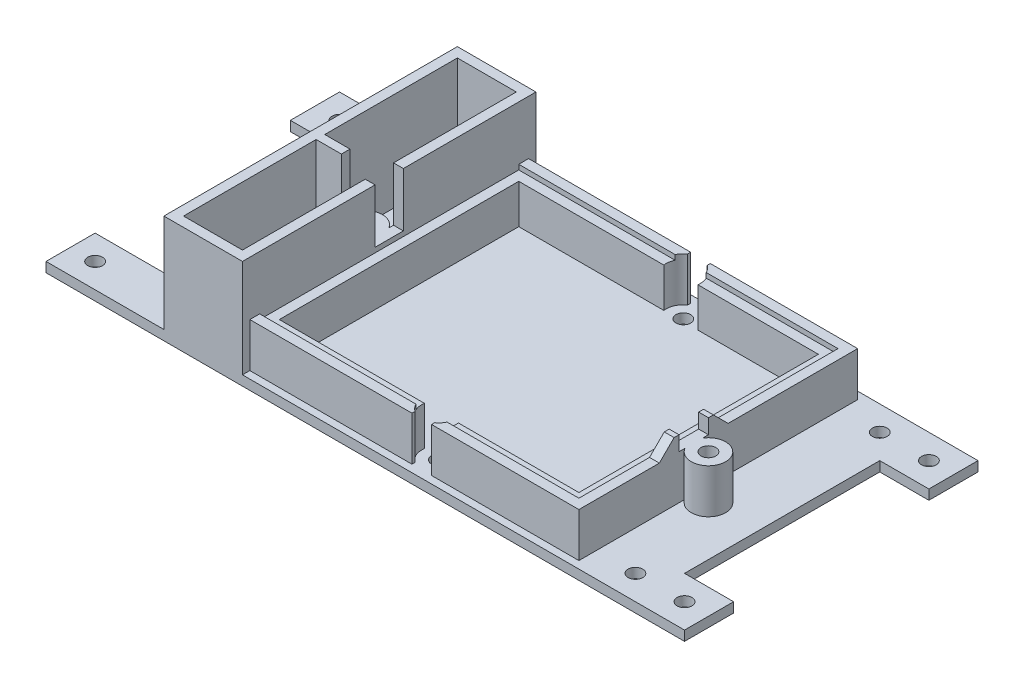
from build123d import *

# Parameters (mm, degrees)
SZKIC1_W                        = 10
SZKIC1_H                        = 10
DODANIE_WYCI_GNI_CIE1_DEPTH     = 2
SZKIC3_R                        = 1.5
DODANIE_WYCI_GNI_CIE2_DEPTH     = 2
DODANIE_WYCI_GNI_CIE11_DEPTH    = 8
DODANIE_WYCI_GNI_CIE12_DEPTH    = 20
DODANIE_WYCI_GNI_CIE13_DEPTH    = 9
SZKIC7_R                        = 1.5
WYTNIJ_WYCI_GNI_CIE1_DEPTH      = 85.018427919
DODANIE_WYCI_GNI_CIE15_DEPTH    = 9
SZKIC9_W                        = 2
SZKIC9_H                        = 25.25
SZKIC9_W_2                      = 5.139687394
SZKIC9_H_2                      = 1
DODANIE_WYCI_GNI_CIE16_DEPTH    = 11
SZKIC10_R                       = 1.5
WYTNIJ_WYCI_GNI_CIE2_DEPTH      = 85.51683992
LUSTRO4_OUTLINE_R               = 1.5
LUSTRO4_DEPTH                   = 2
LUSTRO4_START                   = 2
LUSTRO4_2_DEPTH                 = 8
LUSTRO4_START_2                 = 10
LUSTRO4_3_DEPTH                 = 12
LUSTRO4_4_DEPTH                 = 1
WYTNIJ_WYCI_GNI_CIE3_DEPTH      = 85.018427919
WYTNIJ_WYCI_GNI_CIE3_DEPTH_BACK = 85.018427919
SZKIC11_R                       = 1.5
DODANIE_WYCI_GNI_CIE17_START    = 9
SZKIC12_R                       = 3.5
SZKIC12_R_2                     = 1.5
DODANIE_WYCI_GNI_CIE17_DEPTH    = 9
SZKIC13_W                       = 2
SZKIC13_H                       = 4
DODANIE_WYCI_GNI_CIE18_DEPTH    = 3
SFAZOWANIE2_SIZE                = 3


# Read off the part's stored shape, not the designer's step: Lustro4
with BuildPart() as part:
    # Szkic1 → Dodanie-wyciągnięcie1 (new body)
    with BuildSketch(Plane(origin=(0, 0, 0), x_dir=(1, 0, 0), z_dir=(0, 1, 0))):
        with Locations((-5, -5)):
            Rectangle(SZKIC1_W, SZKIC1_H)
    extrude(amount=DODANIE_WYCI_GNI_CIE1_DEPTH)



with BuildPart() as body_2:
    # Szkic3 → Dodanie-wyciągnięcie2 (new body)
    with BuildSketch(Plane.XZ):
        Polygon((-75.937188702, 29.877074857), (44.062811298, 29.877074857), (54.062811298, 29.877074857), (54.062811298, 19.877074857), (44.062811298, 19.877074857), (44.062811298, -0.122925143), (-57.937188702, -0.122925143), (-57.937188702, 19.877074857), (-75.937188702, 19.877074857), align=None)
        with Locations(Location((-70.937188702, 24.877074857, 0), (0, 0, 270))):
            Circle(SZKIC3_R, mode=Mode.SUBTRACT)
        with Locations(Location((39.062811298, 24.877074857, 0), (0, 0, 270))):
            Circle(SZKIC3_R, mode=Mode.SUBTRACT)
        with Locations(Location((-0.937188702, 24.877074857, 0), (0, 0, 270))):
            Circle(SZKIC3_R, mode=Mode.SUBTRACT)
        with Locations(Location((49.062811298, 24.877074857, 0), (0, 0, 270))):
            Circle(SZKIC3_R, mode=Mode.SUBTRACT)
    extrude(amount=-DODANIE_WYCI_GNI_CIE2_DEPTH)

    # Szkic4 → Dodanie-wyciągnięcie11 (add)
    with BuildSketch(Plane(origin=(0, 2, 0), x_dir=(1, 0, 0), z_dir=(0, 1, 0))):
        with BuildLine():
            Line((29.062811298, 0.122925143), (27.062811298, 0.122925143))
            Line((27.062811298, 0.122925143), (27.062811298, -24.377074857))
            Line((27.062811298, -24.377074857), (4.540036873, -24.377074857))
            Line((4.540036873, -24.377074857), (2.526912913, -24.377074857))
            ThreePointArc((2.526912913, -24.377074857), (2.523624146, -25.399352968), (2.225088958, -26.377074857))
            Line((2.225088958, -26.377074857), (4.35431392, -26.377074857))
            Line((4.35431392, -26.377074857), (29.062811298, -26.377074857))
            Line((29.062811298, -26.377074857), (29.062811298, 0.122925143))
        make_face()
        with BuildLine():
            Line((-35.937188702, 0.122925143), (-35.937188702, -26.377074857))
            Line((-35.937188702, -26.377074857), (-6.228691325, -26.377074857))
            Line((-6.228691325, -26.377074857), (-4.099466363, -26.377074857))
            ThreePointArc((-4.099466363, -26.377074857), (-4.398001551, -25.399352968), (-4.401290318, -24.377074857))
            Line((-4.401290318, -24.377074857), (-6.414414278, -24.377074857))
            Line((-6.414414278, -24.377074857), (-33.937188702, -24.377074857))
            Line((-33.937188702, -24.377074857), (-33.937188702, 0.122925143))
            Line((-33.937188702, 0.122925143), (-35.937188702, 0.122925143))
        make_face()
    extrude(amount=DODANIE_WYCI_GNI_CIE11_DEPTH)

    # Szkic5 → Dodanie-wyciągnięcie12 (add)
    with BuildSketch(Plane(origin=(0, 2, 0), x_dir=(1, 0, 0), z_dir=(0, 1, 0))):
        Polygon((-51.937188702, 0.122925143), (-49.937188702, 0.122925143), (-49.937188702, -27.877074857), (-35.937188702, -27.877074857), (-35.937188702, -29.877074857), (-51.937188702, -29.877074857), align=None)
    extrude(amount=DODANIE_WYCI_GNI_CIE12_DEPTH)

    # Szkic6 → Dodanie-wyciągnięcie13 (add)
    with BuildSketch(Plane(origin=(0, 2, 0), x_dir=(1, 0, 0), z_dir=(0, 1, 0))):
        with BuildLine():
            Line((-37.937188702, 0.122925143), (-35.937188702, 0.122925143))
            Line((-35.937188702, 0.122925143), (-35.937188702, -26.377074857))
            Line((-35.937188702, -26.377074857), (-4.099466363, -26.377074857))
            ThreePointArc((-4.099466363, -26.377074857), (-3.607968863, -27.139138811), (-2.937188702, -27.74935618))
            Line((-2.937188702, -27.74935618), (-2.937188702, -28.377074857))
            Line((-2.937188702, -28.377074857), (-4.507902917, -28.377074857))
            Line((-4.507902917, -28.377074857), (-37.937188702, -28.377074857))
            Line((-37.937188702, -28.377074857), (-37.937188702, 0.122925143))
        make_face()
        with BuildLine():
            Line((31.062811298, 0.122925143), (31.062811298, -28.377074857))
            Line((31.062811298, -28.377074857), (2.633525512, -28.377074857))
            Line((2.633525512, -28.377074857), (1.062811298, -28.377074857))
            Line((1.062811298, -28.377074857), (1.062811298, -27.74935618))
            ThreePointArc((1.062811298, -27.74935618), (1.733591458, -27.139138811), (2.225088958, -26.377074857))
            Line((2.225088958, -26.377074857), (29.062811298, -26.377074857))
            Line((29.062811298, -26.377074857), (29.062811298, 0.122925143))
            Line((29.062811298, 0.122925143), (31.062811298, 0.122925143))
        make_face()
    extrude(amount=DODANIE_WYCI_GNI_CIE13_DEPTH)

    # Szkic7 → Wytnij-wyciągnięcie1 (cut, symmetric)
    with BuildSketch(Plane(origin=(0, 2, 0), x_dir=(1, 0, 0), z_dir=(0, 1, 0))):
        with Locations((-40.937188702, 0.122925143)):
            Circle(SZKIC7_R)
    extrude(amount=WYTNIJ_WYCI_GNI_CIE1_DEPTH, both=True, mode=Mode.SUBTRACT)

    # Szkic8 → Dodanie-wyciągnięcie15 (add)
    with BuildSketch(Plane(origin=(0, 2, 0), x_dir=(1, 0, 0), z_dir=(0, 1, 0))):
        with BuildLine():
            Line((-37.937188702, 0.122925143), (-37.437188702, 0.122925143))
            ThreePointArc((-37.437188702, 0.122925143), (-40.937188702, 3.622925143), (-44.437188702, 0.122925143))
            Line((-44.437188702, 0.122925143), (-49.937188702, 0.122925143))
            Line((-49.937188702, 0.122925143), (-49.937188702, -0.877074857))
            Line((-49.937188702, -0.877074857), (-44.291290669, -0.877074857))
            ThreePointArc((-44.291290669, -0.877074857), (-40.937188702, -3.377074857), (-37.583086736, -0.877074857))
            Line((-37.583086736, -0.877074857), (-37.937188702, -0.877074857))
            Line((-37.937188702, -0.877074857), (-37.937188702, 0.122925143))
        make_face()
    extrude(amount=DODANIE_WYCI_GNI_CIE15_DEPTH)

    # Szkic9 → Dodanie-wyciągnięcie16 (add)
    with BuildSketch(Plane(origin=(0, 11, 0), x_dir=(1, 0, 0), z_dir=(0, 1, 0))):
        with Locations((-36.937188702, -15.502074857)):
            Rectangle(SZKIC9_W, SZKIC9_H)
        with Locations((-47.367345005, -0.377074857)):
            Rectangle(SZKIC9_W_2, SZKIC9_H_2)
    extrude(amount=DODANIE_WYCI_GNI_CIE16_DEPTH)

    # Szkic10 → Wytnij-wyciągnięcie2 (cut, through all)
    with BuildSketch(Plane.XZ):
        with Locations(Location((-40.937188702, -0.122925143, 0), (0, 0, 90))):
            Circle(SZKIC10_R)
    extrude(amount=-WYTNIJ_WYCI_GNI_CIE2_DEPTH, mode=Mode.SUBTRACT)


with BuildPart() as part_1:
    add(part.part)

    add(body_2.part)  # Lustro4 merges body 2
    # Lustro4 outline → Lustro4 (add)
    with BuildSketch(Plane(origin=(0, 0, 0), x_dir=(1, 0, 0), z_dir=(0, 1, 0))):
        with BuildLine():
            Line((-39.437188702, 0.122925143), (44.062811298, 0.122925143))
            Line((44.062811298, 0.122925143), (44.062811298, 19.877074857))
            Line((44.062811298, 19.877074857), (54.062811298, 19.877074857))
            Line((54.062811298, 19.877074857), (54.062811298, 29.877074857))
            Line((54.062811298, 29.877074857), (-75.937188702, 29.877074857))
            Line((-75.937188702, 29.877074857), (-75.937188702, 19.877074857))
            Line((-75.937188702, 19.877074857), (-57.937188702, 19.877074857))
            Line((-57.937188702, 19.877074857), (-57.937188702, 0.122925143))
            Line((-57.937188702, 0.122925143), (-42.437188702, 0.122925143))
            ThreePointArc((-42.437188702, 0.122925143), (-42.435926834, 0.061410823), (-42.432143353, 0))
            ThreePointArc((-42.432143353, 0), (-40.937188702, 1.377074857), (-39.442234051, 0))
            ThreePointArc((-39.442234051, 0), (-39.43845057, 0.061410823), (-39.437188702, 0.122925143))
        make_face()
        with Locations((49.062811298, 24.877074857)):
            Circle(LUSTRO4_OUTLINE_R, mode=Mode.SUBTRACT)
        with Locations((-0.937188702, 24.877074857)):
            Circle(LUSTRO4_OUTLINE_R, mode=Mode.SUBTRACT)
        with Locations((39.062811298, 24.877074857)):
            Circle(LUSTRO4_OUTLINE_R, mode=Mode.SUBTRACT)
        with Locations((-70.937188702, 24.877074857)):
            Circle(LUSTRO4_OUTLINE_R, mode=Mode.SUBTRACT)
    extrude(amount=LUSTRO4_DEPTH)

    # Lustro4 2 outline → Lustro4 2 (add)
    with BuildSketch(Plane(origin=(0, 0, 0), x_dir=(1, 0, 0), z_dir=(0, 1, 0)).offset(LUSTRO4_START)):
        with BuildLine():
            ThreePointArc((-37.937188702, 1.925700781), (-37.564504311, 1.05833949), (-37.437188702, 0.122925143))
            Line((-37.437188702, 0.122925143), (-33.937188702, 0.122925143))
            Line((-33.937188702, 0.122925143), (-33.937188702, 24.377074857))
            Line((-33.937188702, 24.377074857), (-4.401290318, 24.377074857))
            ThreePointArc((-4.401290318, 24.377074857), (-4.147667163, 26.270928527), (-2.937188702, 27.74935618))
            Line((-2.937188702, 27.74935618), (-2.937188702, 28.377074857))
            Line((-2.937188702, 28.377074857), (-35.937188702, 28.377074857))
            Line((-35.937188702, 28.377074857), (-35.937188702, 29.877074857))
            Line((-35.937188702, 29.877074857), (-51.937188702, 29.877074857))
            Line((-51.937188702, 29.877074857), (-51.937188702, 0.122925143))
            Line((-51.937188702, 0.122925143), (-44.437188702, 0.122925143))
            ThreePointArc((-44.437188702, 0.122925143), (-44.416574388, 0.502234055), (-44.354974273, 0.877074857))
            Line((-44.354974273, 0.877074857), (-49.937188702, 0.877074857))
            Line((-49.937188702, 0.877074857), (-49.937188702, 27.877074857))
            Line((-49.937188702, 27.877074857), (-37.937188702, 27.877074857))
            Line((-37.937188702, 27.877074857), (-37.937188702, 1.925700781))
        make_face()
        with BuildLine():
            Line((-44.291290669, -0.877074857), (-44.354974274, -0.877074857))
            ThreePointArc((-44.354974274, -0.877074857), (-41.501582428, -3.577119654), (-37.937188702, -1.925700781))
            Line((-37.937188702, -1.925700781), (-37.937188702, -1.679850495))
            ThreePointArc((-37.937188702, -1.679850495), (-41.37589046, -3.349471834), (-44.291290669, -0.877074857))
        make_face()
        with BuildLine():
            ThreePointArc((-39.442234051, 0), (-40.937188702, 1.622925143), (-42.432143353, 0))
            ThreePointArc((-42.432143353, 0), (-40.937188702, 1.377074857), (-39.442234051, 0))
        make_face()
        with BuildLine():
            Line((27.062811298, 24.377074857), (27.062811298, 0.122925143))
            Line((27.062811298, 0.122925143), (31.062811298, 0.122925143))
            Line((31.062811298, 0.122925143), (31.062811298, 28.377074857))
            Line((31.062811298, 28.377074857), (1.062811298, 28.377074857))
            Line((1.062811298, 28.377074857), (1.062811298, 27.74935618))
            ThreePointArc((1.062811298, 27.74935618), (2.273289758, 26.270928527), (2.526912913, 24.377074857))
            Line((2.526912913, 24.377074857), (27.062811298, 24.377074857))
        make_face()
    extrude(amount=LUSTRO4_2_DEPTH)

    # Lustro4 3 outline → Lustro4 3 (add)
    with BuildSketch(Plane(origin=(0, 0, 0), x_dir=(1, 0, 0), z_dir=(0, 1, 0)).offset(LUSTRO4_START_2)):
        Polygon((-37.937188702, 27.877074857), (-37.937188702, 2.877074857), (-35.937188702, 2.877074857), (-35.937188702, 29.877074857), (-51.937188702, 29.877074857), (-51.937188702, 0.122925143), (-44.797501308, 0.122925143), (-44.797501308, 0.877074857), (-49.937188702, 0.877074857), (-49.937188702, 27.877074857), align=None)
    extrude(amount=LUSTRO4_3_DEPTH)

    # Lustro4 4 outline → Lustro4 4 (add)
    with BuildSketch(Plane(origin=(0, 0, 0), x_dir=(1, 0, 0), z_dir=(0, 1, 0)).offset(LUSTRO4_START_2)):
        with BuildLine():
            Line((-37.937188702, 2.877074857), (-37.937188702, 1.925700781))
            ThreePointArc((-37.937188702, 1.925700781), (-37.564504311, 1.05833949), (-37.437188702, 0.122925143))
            Line((-37.437188702, 0.122925143), (-35.937188702, 0.122925143))
            Line((-35.937188702, 0.122925143), (-35.937188702, 2.877074857))
            Line((-35.937188702, 2.877074857), (-37.937188702, 2.877074857))
        make_face()
        with BuildLine():
            ThreePointArc((-44.437188702, 0.122925143), (-44.416574388, 0.502234055), (-44.354974273, 0.877074857))
            Line((-44.354974273, 0.877074857), (-44.797501308, 0.877074857))
            Line((-44.797501308, 0.877074857), (-44.797501308, 0.122925143))
            Line((-44.797501308, 0.122925143), (-44.437188702, 0.122925143))
        make_face()
        with BuildLine():
            Line((-44.291290669, -0.877074857), (-44.354974274, -0.877074857))
            ThreePointArc((-44.354974274, -0.877074857), (-41.501582428, -3.577119654), (-37.937188702, -1.925700781))
            Line((-37.937188702, -1.925700781), (-37.937188702, -1.679850495))
            ThreePointArc((-37.937188702, -1.679850495), (-41.37589046, -3.349471834), (-44.291290669, -0.877074857))
        make_face()
        with BuildLine():
            ThreePointArc((-39.442234051, 0), (-40.937188702, 1.622925143), (-42.432143353, 0))
            ThreePointArc((-42.432143353, 0), (-40.937188702, 1.377074857), (-39.442234051, 0))
        make_face()
        with BuildLine():
            Line((-35.937188702, 28.377074857), (-35.937188702, 26.377074857))
            Line((-35.937188702, 26.377074857), (-4.099466363, 26.377074857))
            ThreePointArc((-4.099466363, 26.377074857), (-3.607968863, 27.139138811), (-2.937188702, 27.74935618))
            Line((-2.937188702, 27.74935618), (-2.937188702, 28.377074857))
            Line((-2.937188702, 28.377074857), (-35.937188702, 28.377074857))
        make_face()
        with BuildLine():
            Line((29.062811298, 26.377074857), (29.062811298, 0.122925143))
            Line((29.062811298, 0.122925143), (31.062811298, 0.122925143))
            Line((31.062811298, 0.122925143), (31.062811298, 28.377074857))
            Line((31.062811298, 28.377074857), (1.062811298, 28.377074857))
            Line((1.062811298, 28.377074857), (1.062811298, 27.74935618))
            ThreePointArc((1.062811298, 27.74935618), (1.733591458, 27.139138811), (2.225088958, 26.377074857))
            Line((2.225088958, 26.377074857), (29.062811298, 26.377074857))
        make_face()
    extrude(amount=LUSTRO4_4_DEPTH)

    # Szkic11 → Wytnij-wyciągnięcie3 (cut, two sides: drawn at the far end of the back side and taken through both)
    with BuildSketch(Plane(origin=(0, 2, 0), x_dir=(1, 0, 0), z_dir=(0, 1, 0)).offset(-WYTNIJ_WYCI_GNI_CIE3_DEPTH_BACK)):
        with Locations(Location((34.062811298, -5, 0), (0, 0, 270))):
            Circle(SZKIC11_R)
    extrude(amount=WYTNIJ_WYCI_GNI_CIE3_DEPTH + WYTNIJ_WYCI_GNI_CIE3_DEPTH_BACK, mode=Mode.SUBTRACT)

    # Szkic12 → Dodanie-wyciągnięcie17 (add)
    with BuildSketch(Plane(origin=(0, 2, 0), x_dir=(1, 0, 0), z_dir=(0, 1, 0)).offset(DODANIE_WYCI_GNI_CIE17_START)):
        with Locations((34.062811298, -5)):
            Circle(SZKIC12_R)
        with Locations(Location((34.062811298, -5, 0), (0, 0, 270))):
            Circle(SZKIC12_R_2, mode=Mode.SUBTRACT)
    extrude(amount=-DODANIE_WYCI_GNI_CIE17_DEPTH)

    # Szkic13 → Dodanie-wyciągnięcie18 (add)
    with BuildSketch(Plane(origin=(0, 11, 0), x_dir=(1, 0, 0), z_dir=(0, 1, 0))):
        with Locations((30.062811298, 0)):
            Rectangle(SZKIC13_W, SZKIC13_H)
        with Locations((30.062811298, -10)):
            Rectangle(SZKIC13_W, SZKIC13_H)
    extrude(amount=DODANIE_WYCI_GNI_CIE18_DEPTH)

    # Sfazowanie2
    sfazowanie2_edges = [part_1.edges().sort_by_distance(p)[0] for p in [
        (30.062811298, 14, 12),
        (30.062811298, 14, -2),
    ]]
    chamfer(sfazowanie2_edges, length=SFAZOWANIE2_SIZE - 0.0001)  # a hair under: the kernel refuses the full size


solid = part_1.part
